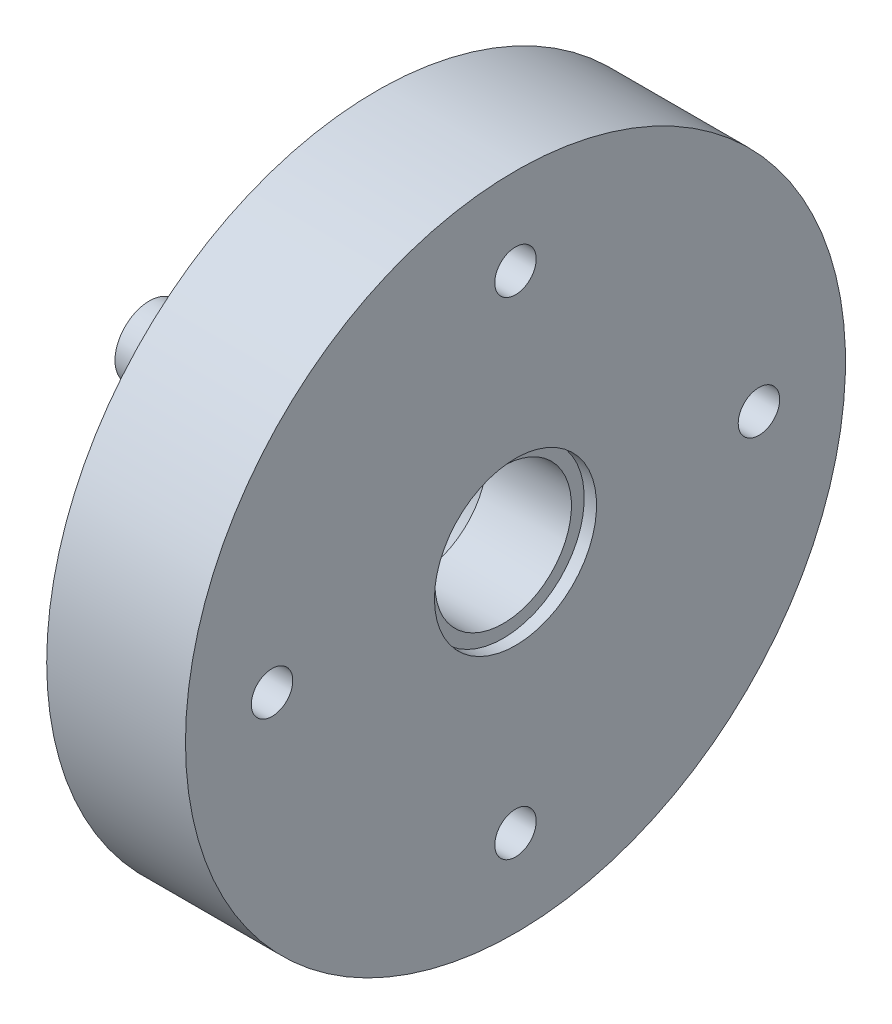
from build123d import *

# Parameters (mm, degrees)
CBORE_FOR_M3_HEX_SOCKET_HEAD_CAP_SCR_2_COUNT = 2
CBORE_FOR_M3_HEX_SOCKET_HEAD_CAP_SCR_2_PITCH = 28.243387552
CBORE_FOR_M3_HEX_SOCKET_HEAD_CAP_SCR_3_COUNT = 2
CBORE_FOR_M3_HEX_SOCKET_HEAD_CAP_SCR_3_PITCH = 39.942181723
CBORE_FOR_M3_HEX_SOCKET_HEAD_CAP_SCR_4_COUNT = 2
CBORE_FOR_M3_HEX_SOCKET_HEAD_CAP_SCR_4_PITCH = 28.243387552


with BuildPart() as part:
    # Sketch1 → Revolve17 (revolve)
    with BuildSketch(Plane.XY):
        Polygon((-71.291859268, 14.884170222), (-71.291859268, 14.534170222), (-66.841859268, 14.884170222), (-66.841859268, 14.534170222), (-62.371609448, 14.884170222), (-62.371609448, 14.534170222), (-59.488918076, 23.788045652), (-57.091214807, 23.788045652), (-57.091214807, 38.788045652), (-45.705811648, 38.788045652), (-45.705811648, 19.977485582), (-45.705811648, 18.364170222), (-46.715811648, 18.364170222), (-46.715811648, 17.314170222), (-53.637545484, 17.314170222), (-59.488918076, 13.399170222), (-75.741859268, 13.399170222), (-75.741859268, 14.534170222), align=None)
    revolve(axis=Axis((-795.163849313, 11.714170222, 0), (1, 0, 0)))

    # Sketch4 → CBORE for M3 Hex Socket Head Cap Screw1 (revolve, cut)
    with BuildSketch(Plane(origin=(-57.091214807, 11.714170222, -19.971090862), x_dir=(0, 0, 1), z_dir=(0, 1, 0))):
        Polygon((0, 0), (0, 11.385403159), (1.7, 11.385403159), (1.7, 3.4), (1.675, 3.4), (1.675, 0.025), (1.7, 0), align=None)
    cbore_for_m3_hex_socket_head_cap_screw1 = revolve(axis=Axis((-63.441214807, 11.714170222, -19.971090862), (1, 0, 0)), mode=Mode.SUBTRACT)

    # CBORE for M3 Hex Socket Head Cap Scr 2: CBORE for M3 Hex Socket Head Cap Screw1 ×2
    with Locations(*[Vector(0, 0.7071067811865475, 0.7071067811865476) * (i * CBORE_FOR_M3_HEX_SOCKET_HEAD_CAP_SCR_2_PITCH) for i in range(1, CBORE_FOR_M3_HEX_SOCKET_HEAD_CAP_SCR_2_COUNT)]):
        add(cbore_for_m3_hex_socket_head_cap_screw1, mode=Mode.SUBTRACT)

    # CBORE for M3 Hex Socket Head Cap Scr 3: CBORE for M3 Hex Socket Head Cap Screw1 ×2
    with Locations(*[(0, 0, i * CBORE_FOR_M3_HEX_SOCKET_HEAD_CAP_SCR_3_PITCH) for i in range(1, CBORE_FOR_M3_HEX_SOCKET_HEAD_CAP_SCR_3_COUNT)]):
        add(cbore_for_m3_hex_socket_head_cap_screw1, mode=Mode.SUBTRACT)

    # CBORE for M3 Hex Socket Head Cap Scr 4: CBORE for M3 Hex Socket Head Cap Screw1 ×2
    with Locations(*[Vector(0, -0.7071067811865476, 0.7071067811865475) * (i * CBORE_FOR_M3_HEX_SOCKET_HEAD_CAP_SCR_4_PITCH) for i in range(1, CBORE_FOR_M3_HEX_SOCKET_HEAD_CAP_SCR_4_COUNT)]):
        add(cbore_for_m3_hex_socket_head_cap_screw1, mode=Mode.SUBTRACT)


solid = part.part
